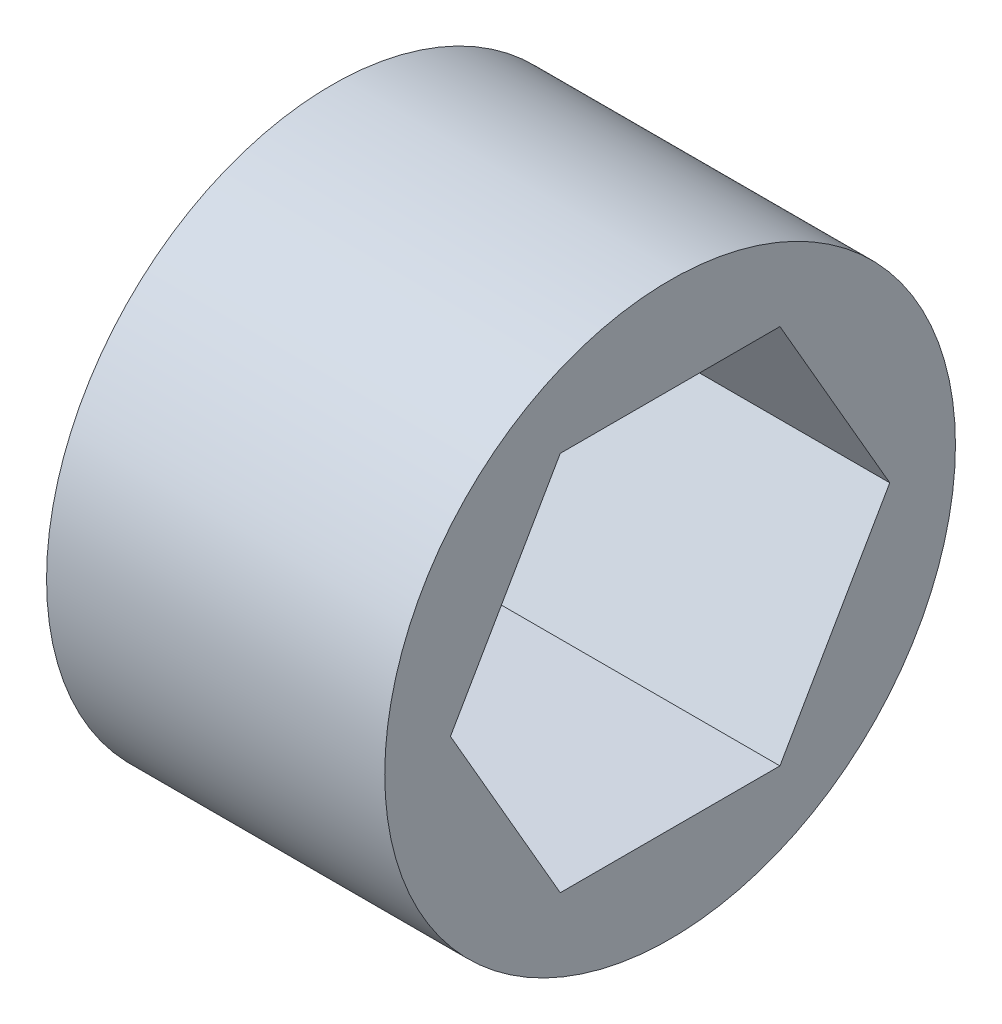
from build123d import *

# Parameters (mm, degrees)
SKETCH1_R           = 9.525
BOSS_EXTRUDE1_DEPTH = 11.288888889


with BuildPart() as part:
    # Sketch1 → Boss-Extrude1 (new body)
    with BuildSketch(Plane(origin=(0, 0, 0), x_dir=(0, 0, -1), z_dir=(1, 0, 0))):
        Circle(SKETCH1_R)
        Polygon((7.332348419, 0), (3.666174209, 6.35), (-3.666174209, 6.35), (-7.332348419, 0), (-3.666174209, -6.35), (3.666174209, -6.35), align=None, mode=Mode.SUBTRACT)
    extrude(amount=BOSS_EXTRUDE1_DEPTH)


solid = part.part
